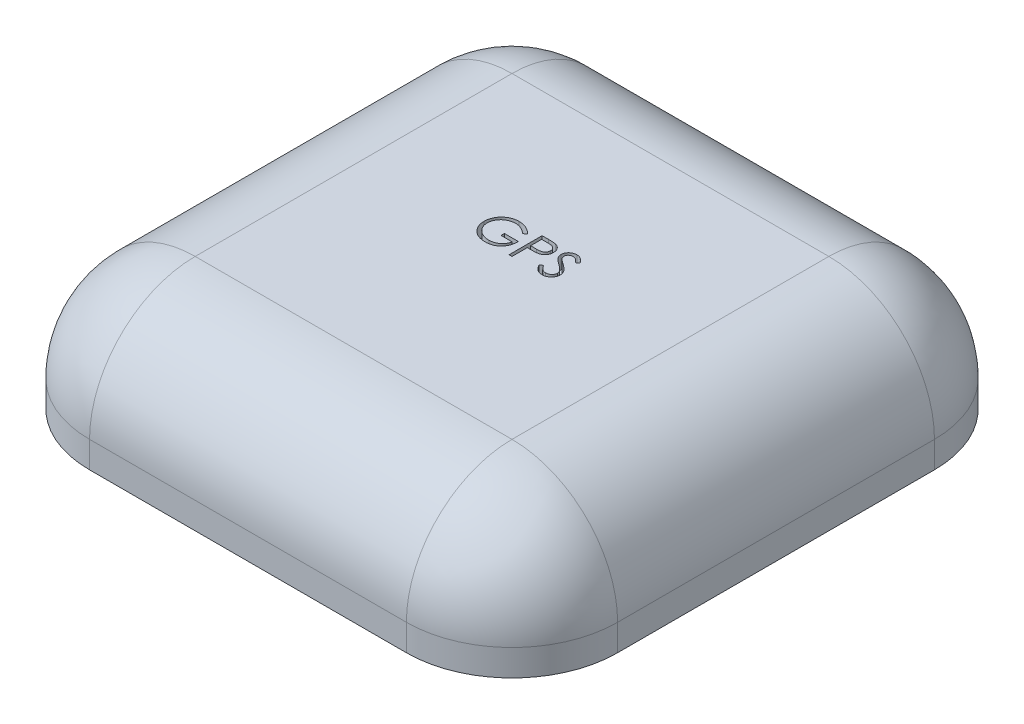
from build123d import *

# Parameters (mm, degrees)
SKETCH1_W           = 50.8
SKETCH1_H           = 50.8
BOSS_EXTRUDE1_DEPTH = 12.7
FILLET1_R           = 10.16
CUT_EXTRUDE1_DEPTH  = 1.27


with BuildPart() as part:
    # Sketch1 → Boss-Extrude1 (new body)
    with BuildSketch(Plane(origin=(0, 0, 0), x_dir=(1, 0, 0), z_dir=(0, 1, 0))):
        Rectangle(SKETCH1_W, SKETCH1_H)
    extrude(amount=BOSS_EXTRUDE1_DEPTH)

    # Fillet1
    fillet1_edges = [part.edges().sort_by_distance(p)[0] for p in [
        (-25.4, 6.35, -25.4),
        (25.4, 6.35, -25.4),
        (25.4, 6.35, 25.4),
        (-25.4, 6.35, 25.4),
        (-25.4, 12.7, 0),
        (0, 12.7, -25.4),
        (25.4, 12.7, 0),
        (0, 12.7, 25.4),
    ]]
    fillet(fillet1_edges, radius=FILLET1_R)

    # Sketch2 → Cut-Extrude1 (cut)
    # profile 1 of 3: a face of its own
    with BuildSketch(Plane(origin=(0, 12.7, 0), x_dir=(1, 0, 0), z_dir=(0, 1, 0))):
        with BuildLine():
            Line((-1.135791938, 2.633112981), (-1.380022707, 2.401602564))
            add(Edge.make_bspline(
                [(-1.380022707, 2.401602564), (-1.424217699, 2.443177704), (-1.511553827, 2.525336601), (-1.65393919, 2.631935861), (-1.802496201, 2.723254395), (-1.95644968, 2.797555052), (-2.111987082, 2.856839342), (-2.267043901, 2.899047012), (-2.420029644, 2.925964242), (-2.521781335, 2.92918312), (-2.571919743, 2.930769231)],
                knots=[0, 0, 0, 0, 1.08915593, 2.152340314, 3.188132944, 4.216796309, 5.218260357, 6.173443236, 7.099959455, 8, 8, 8, 8], degree=3))
            add(Edge.make_bspline(
                [(-2.571919743, 2.930769231), (-2.60268522, 2.930394031), (-2.664136384, 2.929644605), (-2.755414862, 2.920079495), (-2.845736026, 2.906322797), (-2.934929373, 2.88641838), (-3.023168326, 2.86119159), (-3.110145992, 2.829636205), (-3.196024621, 2.792846805), (-3.27999528, 2.750335847), (-3.361402737, 2.703636272), (-3.438289295, 2.651885096), (-3.511145021, 2.596740979), (-3.57860055, 2.536823305), (-3.641043898, 2.47267482), (-3.69996135, 2.405488821), (-3.753280754, 2.33342973), (-3.801442025, 2.257823341), (-3.844405779, 2.179997569), (-3.8823322, 2.1007015), (-3.914170273, 2.020198146), (-3.939361136, 1.93838649), (-3.960144372, 1.855899455), (-3.974765344, 1.772165887), (-3.983008299, 1.687096129), (-3.984434128, 1.630130045), (-3.985150913, 1.601492388)],
                knots=[0, 0, 0, 0, 1.02818874, 2.053710826, 3.065248034, 4.081641283, 5.106893873, 6.131558223, 7.173050175, 8.228653731, 9.27666206, 10.308777013, 11.325269123, 12.329503258, 13.32196095, 14.316845687, 15.314881793, 16.315733098, 17.311955233, 18.285320748, 19.252783886, 20.203351036, 21.145449891, 22.095197417, 23.042428769, 24, 24, 24, 24], degree=3))
            add(Edge.make_bspline(
                [(-3.985150913, 1.601492388), (-3.984465368, 1.572218146), (-3.983096151, 1.513749602), (-3.974332861, 1.426487836), (-3.958069386, 1.340522078), (-3.93632725, 1.255569843), (-3.909130367, 1.17148564), (-3.87522802, 1.088634006), (-3.835072797, 1.007018008), (-3.788593925, 0.927373027), (-3.737625012, 0.849791427), (-3.680526645, 0.776712433), (-3.619874545, 0.707162899), (-3.553459078, 0.642687027), (-3.483409922, 0.581560207), (-3.407634215, 0.525466555), (-3.327621983, 0.473325596), (-3.243251155, 0.425794467), (-3.155437202, 0.383332438), (-3.065397148, 0.345573618), (-2.972843343, 0.314477362), (-2.878262189, 0.289133511), (-2.781766436, 0.26835967), (-2.682866272, 0.254995206), (-2.582288886, 0.245297095), (-2.51449027, 0.244588008), (-2.480333204, 0.244230769)],
                knots=[0, 0, 0, 0, 0.93586088, 1.869166235, 2.799637598, 3.729985548, 4.670839027, 5.622275134, 6.589130586, 7.576015415, 8.568469353, 9.55398029, 10.53834874, 11.515998671, 12.510579167, 13.508179873, 14.527009472, 15.561807829, 16.601455013, 17.643573243, 18.680854198, 19.719860599, 20.772568776, 21.833555941, 22.908541556, 24, 24, 24, 24], degree=3))
            add(Edge.make_bspline(
                [(-2.480333204, 0.244230769), (-2.439168561, 0.245091263), (-2.358335095, 0.246780984), (-2.239511679, 0.259934818), (-2.125390322, 0.280478695), (-2.016291695, 0.310564901), (-1.912089083, 0.348940378), (-1.812400487, 0.395200478), (-1.718010768, 0.451119539), (-1.628636175, 0.514232975), (-1.546306442, 0.584550002), (-1.472053058, 0.660427472), (-1.407060364, 0.741497075), (-1.350359673, 0.827281326), (-1.303452536, 0.918490281), (-1.264950858, 1.014676963), (-1.235438515, 1.115884634), (-1.223323645, 1.185817757), (-1.217202195, 1.221153846)],
                knots=[0, 0, 0, 0, 1.13008108, 2.219097802, 3.278683437, 4.311054135, 5.322181354, 6.324827112, 7.324222904, 8.330512327, 9.32562643, 10.293043162, 11.24128371, 12.174520618, 13.111833804, 14.052305215, 15.015860969, 16, 16, 16, 16], degree=3))
            Line((-1.217202195, 1.221153846), (-2.275535528, 1.221153846))
            Line((-2.275535528, 1.221153846), (-2.275535528, 1.546794872))
            Line((-2.275535528, 1.546794872), (-0.932266297, 1.546794872))
            add(Edge.make_bspline(
                [(-0.932266297, 1.546794872), (-0.933813745, 1.486100221), (-0.936842381, 1.367309826), (-0.958086683, 1.194072509), (-0.992391662, 1.030449616), (-1.039254945, 0.876268829), (-1.099920378, 0.731748642), (-1.173736886, 0.59674232), (-1.261885881, 0.472122045), (-1.361227496, 0.356870449), (-1.472715315, 0.254064664), (-1.593336849, 0.163707849), (-1.723291384, 0.087596191), (-1.862455995, 0.025674018), (-2.010375103, -0.022653106), (-2.16739099, -0.056917322), (-2.333290728, -0.077445931), (-2.446988999, -0.080068825), (-2.505137892, -0.081410256)],
                knots=[0, 0, 0, 0, 1.140356446, 2.231883559, 3.274166699, 4.278491846, 5.25512956, 6.21435461, 7.1637429, 8.11826594, 9.068280886, 10.0076534, 10.945064095, 11.891975133, 12.864533718, 13.863980011, 14.907571808, 16, 16, 16, 16], degree=3))
            add(Edge.make_bspline(
                [(-2.505137892, -0.081410256), (-2.540979229, -0.080893982), (-2.611669897, -0.079875723), (-2.71607381, -0.072639129), (-2.81759908, -0.061498892), (-2.916230917, -0.044675816), (-3.012332127, -0.02407038), (-3.105422751, 0.00231543), (-3.195857403, 0.03285775), (-3.283775861, 0.067597396), (-3.368380128, 0.107848828), (-3.45004704, 0.152579715), (-3.529228026, 0.201559407), (-3.605383725, 0.25563496), (-3.678910939, 0.314401906), (-3.749335563, 0.377978032), (-3.817051852, 0.446168976), (-3.859470273, 0.494591364), (-3.880844022, 0.518990385)],
                knots=[0, 0, 0, 0, 1.107784379, 2.184907829, 3.233506516, 4.263428166, 5.276301166, 6.270063455, 7.25232949, 8.225834625, 9.190232166, 10.146266622, 11.1027726, 12.066435141, 13.031522626, 14.010570082, 14.99756817, 16, 16, 16, 16], degree=3))
            add(Edge.make_bspline(
                [(-3.880844022, 0.518990385), (-3.911855546, 0.557698763), (-3.973363834, 0.634473), (-4.05253759, 0.757481521), (-4.120030292, 0.884846065), (-4.17479253, 1.016921192), (-4.217553509, 1.153583364), (-4.248220609, 1.29465795), (-4.26618865, 1.440326615), (-4.268777216, 1.538901533), (-4.27008681, 1.588772035)],
                knots=[0, 0, 0, 0, 1.023165419, 2.029347347, 3.013907458, 3.994755782, 4.975994455, 5.96558838, 6.970761222, 8, 8, 8, 8], degree=3))
            add(Edge.make_bspline(
                [(-4.27008681, 1.588772035), (-4.269603994, 1.626115707), (-4.268644498, 1.700328436), (-4.257009923, 1.810507565), (-4.240317208, 1.918730336), (-4.215781666, 2.024908283), (-4.184851483, 2.12911232), (-4.146249392, 2.23139083), (-4.101305093, 2.331804171), (-4.049066822, 2.42966118), (-3.990933062, 2.523663326), (-3.927841076, 2.61343219), (-3.858894953, 2.697332985), (-3.785220621, 2.776428266), (-3.705939066, 2.849724363), (-3.621793017, 2.917899877), (-3.532717627, 2.98104626), (-3.438432664, 3.038168896), (-3.340345407, 3.08948018), (-3.238690978, 3.134464679), (-3.133500406, 3.171642401), (-3.025561765, 3.203187187), (-2.914058032, 3.226514493), (-2.799798367, 3.243431569), (-2.682187194, 3.255007256), (-2.602688796, 3.255938217), (-2.562379478, 3.256410256)],
                knots=[0, 0, 0, 0, 1.008945113, 2.00506715, 2.99143336, 3.967273523, 4.948097931, 5.927297278, 6.919902385, 7.919676788, 8.923139349, 9.905703106, 10.883022732, 11.856032218, 12.825136022, 13.798837087, 14.781400844, 15.773989409, 16.776158564, 17.77167057, 18.775803737, 19.789618931, 20.80898985, 21.851988756, 22.910860228, 24, 24, 24, 24], degree=3))
            add(Edge.make_bspline(
                [(-2.562379478, 3.256410256), (-2.529506214, 3.255884575), (-2.464322395, 3.254842209), (-2.367325481, 3.247617136), (-2.271827817, 3.236165472), (-2.177687807, 3.220538316), (-2.085226032, 3.199253397), (-1.994179092, 3.173782381), (-1.904415005, 3.144126228), (-1.816215093, 3.108757774), (-1.728986308, 3.068613415), (-1.642243639, 3.023425524), (-1.556283466, 2.972421413), (-1.470956718, 2.915449634), (-1.385725333, 2.853488677), (-1.301937407, 2.784766415), (-1.217570451, 2.711992915), (-1.163321662, 2.659666934), (-1.135791938, 2.633112981)],
                knots=[0, 0, 0, 0, 0.985871117, 1.954866573, 2.915460327, 3.869826059, 4.81536089, 5.759505086, 6.70452669, 7.649098992, 8.607881297, 9.583363685, 10.581137262, 11.603961102, 12.659522466, 13.73993555, 14.853081303, 16, 16, 16, 16], degree=3))
        make_face()
    # profile 2 of 3: a face of its own
    with BuildSketch(Plane(origin=(0, 12.7, 0), x_dir=(1, 0, 0), z_dir=(0, 1, 0))):
        with BuildLine():
            Line((-0.280984246, 3.175), (0.341677012, 3.175))
            add(Edge.make_bspline(
                [(0.341677012, 3.175), (0.384504048, 3.174952923), (0.466562552, 3.17486272), (0.584232638, 3.172127915), (0.691102895, 3.16847513), (0.786942883, 3.163411556), (0.872047486, 3.157427506), (0.946031608, 3.149034585), (1.009476777, 3.140271317), (1.047491913, 3.131361898), (1.064829055, 3.127298678)],
                knots=[0, 0, 0, 0, 1.415646017, 2.712440637, 3.8905458, 4.950247383, 5.884950622, 6.709939814, 7.411656543, 8, 8, 8, 8], degree=3))
            add(Edge.make_bspline(
                [(1.064829055, 3.127298678), (1.086776047, 3.121291623), (1.130152876, 3.109419063), (1.192655965, 3.085639471), (1.252122668, 3.057443507), (1.30875701, 3.025308933), (1.361863043, 2.987857028), (1.412233094, 2.946605961), (1.459422648, 2.900603324), (1.503166339, 2.850365081), (1.543338977, 2.796734605), (1.577928046, 2.738911296), (1.606890602, 2.677868471), (1.631731141, 2.613648589), (1.649609525, 2.545712367), (1.663077784, 2.474531849), (1.67162636, 2.400114666), (1.672445113, 2.349260357), (1.672861908, 2.323372396)],
                knots=[0, 0, 0, 0, 0.999701418, 1.975846123, 2.934577507, 3.890451536, 4.834027766, 5.787354733, 6.749476667, 7.726910423, 8.712836071, 9.690891519, 10.682875813, 11.679750201, 12.712814741, 13.765529915, 14.8625177, 16, 16, 16, 16], degree=3))
            add(Edge.make_bspline(
                [(1.672861908, 2.323372396), (1.672479616, 2.297266841), (1.671731635, 2.24618956), (1.66275429, 2.171465674), (1.650661902, 2.100056849), (1.632068147, 2.032121418), (1.607715287, 1.968062827), (1.579147496, 1.906902138), (1.544691008, 1.849679864), (1.505098912, 1.796188264), (1.46105568, 1.74637713), (1.412747658, 1.700607423), (1.360369871, 1.659147059), (1.304088779, 1.62190309), (1.243355702, 1.589739179), (1.179091749, 1.560930767), (1.110738338, 1.536736305), (1.063437629, 1.524009035), (1.03938835, 1.517538061)],
                knots=[0, 0, 0, 0, 1.121902311, 2.195077645, 3.232258892, 4.234102512, 5.217864754, 6.176164875, 7.132989551, 8.084763148, 9.034132444, 9.988522005, 10.94243251, 11.903244335, 12.886203696, 13.894208494, 14.929344452, 16, 16, 16, 16], degree=3))
            add(Edge.make_bspline(
                [(1.03938835, 1.517538061), (1.019497126, 1.513308071), (0.975904351, 1.504037802), (0.904110596, 1.493688702), (0.820521567, 1.484855307), (0.725251356, 1.478232132), (0.618385478, 1.472562155), (0.499866123, 1.468055384), (0.369460639, 1.465579017), (0.278500296, 1.465451298), (0.231009945, 1.465384615)],
                knots=[0, 0, 0, 0, 0.601384939, 1.31797006, 2.144135048, 3.087295005, 4.142315834, 5.309527816, 6.595305764, 8, 8, 8, 8], degree=3))
            Line((0.231009945, 1.465384615), (0.003951652, 1.465384615))
            Line((0.003951652, 1.465384615), (0.003951652, 0))
            Line((0.003951652, 0), (-0.280984246, 0))
            Line((-0.280984246, 0), (-0.280984246, 3.175))
        make_face()
        with BuildLine():
            Line((0.003951652, 2.849358974), (0.003951652, 1.791025641))
            Line((0.003951652, 1.791025641), (0.559831059, 1.784029447))
            add(Edge.make_bspline(
                [(0.559831059, 1.784029447), (0.586972706, 1.784015419), (0.639369096, 1.783988339), (0.715057669, 1.787603506), (0.785278952, 1.791776847), (0.849817245, 1.797887291), (0.908701643, 1.806524432), (0.962030329, 1.815243652), (1.009389793, 1.827857802), (1.064815498, 1.8448423), (1.12657682, 1.873809745), (1.193766668, 1.915855716), (1.250708557, 1.969450359), (1.299983012, 2.029709891), (1.339086201, 2.096746959), (1.367711994, 2.16847378), (1.384531472, 2.244154758), (1.386786805, 2.295941855), (1.387926011, 2.322100361)],
                knots=[0, 0, 0, 0, 1.160613943, 2.240541288, 3.23993089, 4.169200891, 5.011653406, 5.7853311, 6.478053781, 7.106038997, 8.262395093, 9.384106736, 10.481365981, 11.59014053, 12.70357646, 13.786202915, 14.881775077, 16, 16, 16, 16], degree=3))
            add(Edge.make_bspline(
                [(1.387926011, 2.322100361), (1.38678061, 2.347626012), (1.384503695, 2.398367848), (1.367580162, 2.472734295), (1.339141856, 2.543705256), (1.299720516, 2.609902269), (1.251876777, 2.669944969), (1.196269516, 2.722103078), (1.133029629, 2.764032765), (1.074203019, 2.791095813), (1.021950515, 2.80761967), (0.97656438, 2.819181061), (0.925319268, 2.82841179), (0.868198496, 2.835886196), (0.805644797, 2.842284693), (0.737120754, 2.846626258), (0.662885949, 2.849167579), (0.611350646, 2.849293631), (0.584635746, 2.849358974)],
                knots=[0, 0, 0, 0, 1.120700087, 2.227813068, 3.331159281, 4.466773991, 5.599788987, 6.693661531, 7.80175334, 8.91857717, 9.525282508, 10.207424825, 10.974604443, 11.810962634, 12.737642355, 13.736264703, 14.826523623, 16, 16, 16, 16], degree=3))
            Line((0.584635746, 2.849358974), (0.003951652, 2.849358974))
        make_face(mode=Mode.SUBTRACT)
    # profile 3 of 3: a face of its own
    with BuildSketch(Plane(origin=(0, 12.7, 0), x_dir=(1, 0, 0), z_dir=(0, 1, 0))):
        with BuildLine():
            Line((1.998502934, 0.612484976), (2.266902373, 0.773397436))
            add(Edge.make_bspline(
                [(2.266902373, 0.773397436), (2.291865345, 0.731610458), (2.339693437, 0.651548221), (2.419477884, 0.543364142), (2.502148453, 0.451414185), (2.588317349, 0.376233263), (2.677458602, 0.317043201), (2.770154136, 0.275131177), (2.866091579, 0.24899097), (2.931382117, 0.245815892), (2.963977693, 0.244230769)],
                knots=[0, 0, 0, 0, 1.272034388, 2.437168799, 3.508375237, 4.49857839, 5.41946034, 6.295179144, 7.148887113, 8, 8, 8, 8], degree=3))
            add(Edge.make_bspline(
                [(2.963977693, 0.244230769), (2.99181506, 0.245006079), (3.047002704, 0.246543133), (3.128248453, 0.261312147), (3.207153373, 0.284001721), (3.282091209, 0.316496423), (3.352027945, 0.355810621), (3.413356876, 0.403296082), (3.46637585, 0.456460283), (3.509745547, 0.515771691), (3.543019579, 0.57955939), (3.568593812, 0.645033288), (3.582786129, 0.713221918), (3.584924041, 0.759132838), (3.586002934, 0.782301683)],
                knots=[0, 0, 0, 0, 1.095163259, 2.171163733, 3.241058638, 4.321873601, 5.38011039, 6.391990106, 7.366004449, 8.327778327, 9.272591725, 10.192022065, 11.087607919, 12, 12, 12, 12], degree=3))
            add(Edge.make_bspline(
                [(3.586002934, 0.782301683), (3.584665523, 0.808736596), (3.581946763, 0.862474913), (3.558967492, 0.941758884), (3.522818532, 1.020220001), (3.489469563, 1.068753292), (3.472155778, 1.093950321)],
                knots=[0, 0, 0, 0, 0.938893495, 1.908633276, 2.914225137, 4, 4, 4, 4], degree=3))
            add(Edge.make_bspline(
                [(3.472155778, 1.093950321), (3.457940292, 1.112135653), (3.428096658, 1.150313485), (3.376790915, 1.207141663), (3.316587368, 1.2657598), (3.249546286, 1.32840623), (3.173225556, 1.392167303), (3.090015596, 1.460083527), (2.997791953, 1.5295721), (2.933113124, 1.576174356), (2.899739913, 1.600220353)],
                knots=[0, 0, 0, 0, 0.722233717, 1.516239348, 2.393582979, 3.351407094, 4.387010283, 5.505090956, 6.712668013, 8, 8, 8, 8], degree=3))
            add(Edge.make_bspline(
                [(2.899739913, 1.600220353), (2.866335288, 1.624013428), (2.802468188, 1.669503978), (2.713152188, 1.737017435), (2.633283283, 1.798742946), (2.563216461, 1.855261585), (2.502982541, 1.90658102), (2.452106875, 1.952208436), (2.41188547, 1.993377809), (2.389519336, 2.020085312), (2.379477493, 2.032076322)],
                knots=[0, 0, 0, 0, 1.452282411, 2.77665338, 3.964542531, 5.026858415, 5.96415736, 6.766646006, 7.446254459, 8, 8, 8, 8], degree=3))
            add(Edge.make_bspline(
                [(2.379477493, 2.032076322), (2.365441684, 2.050764406), (2.337838382, 2.08751703), (2.301402077, 2.144961722), (2.270432979, 2.203765684), (2.246155721, 2.264086933), (2.225712151, 2.325078618), (2.211961743, 2.387536534), (2.20335169, 2.451180424), (2.202469959, 2.494009814), (2.202028575, 2.51544972)],
                knots=[0, 0, 0, 0, 1.068054152, 2.10047183, 3.106115577, 4.101338837, 5.06977816, 6.043150881, 7.020423561, 8, 8, 8, 8], degree=3))
            add(Edge.make_bspline(
                [(2.202028575, 2.51544972), (2.203212586, 2.549041015), (2.2055553, 2.615505616), (2.225367769, 2.712597869), (2.256639609, 2.805295548), (2.300449971, 2.892680922), (2.356926284, 2.972478633), (2.422282275, 3.045606582), (2.500125552, 3.107082367), (2.585535432, 3.160796163), (2.679022284, 3.202838538), (2.77698546, 3.234553141), (2.879580661, 3.252522968), (2.949070648, 3.255101762), (2.984330257, 3.256410256)],
                knots=[0, 0, 0, 0, 1.005424448, 1.989358655, 2.955360095, 3.929531133, 4.905563448, 5.876582895, 6.856512386, 7.866279853, 8.892233794, 9.918561126, 10.94386622, 12, 12, 12, 12], degree=3))
            add(Edge.make_bspline(
                [(2.984330257, 3.256410256), (3.021744548, 3.255119799), (3.096149632, 3.252553491), (3.205595706, 3.230240016), (3.31097007, 3.193318692), (3.39573646, 3.151418981), (3.462078322, 3.109571197), (3.512672158, 3.071453213), (3.56394156, 3.027570079), (3.616300081, 2.977804906), (3.668860537, 2.921701067), (3.72240324, 2.8596428), (3.777053398, 2.792009352), (3.8122105, 2.743727127), (3.830233703, 2.718975361)],
                knots=[0, 0, 0, 0, 1.286793592, 2.559021753, 3.825965368, 5.121522368, 5.803751409, 6.523245864, 7.299691795, 8.125521123, 9.008227632, 9.944561021, 10.946284179, 12, 12, 12, 12], degree=3))
            Line((3.830233703, 2.718975361), (3.572646563, 2.523717949))
            add(Edge.make_bspline(
                [(3.572646563, 2.523717949), (3.557092753, 2.543755546), (3.527139751, 2.582343275), (3.481665146, 2.636382968), (3.438803872, 2.685746489), (3.396576009, 2.728622712), (3.357211787, 2.767359647), (3.319005613, 2.80052457), (3.282507308, 2.828442431), (3.236499825, 2.858236232), (3.178698752, 2.887769632), (3.106141351, 2.912760581), (3.030316659, 2.927778387), (2.97867335, 2.929764021), (2.952529376, 2.930769231)],
                knots=[0, 0, 0, 0, 1.181633172, 2.275549214, 3.290209073, 4.226197932, 5.078386478, 5.862611352, 6.581680152, 7.217281963, 8.414376989, 9.595101626, 10.782541182, 12, 12, 12, 12], degree=3))
            add(Edge.make_bspline(
                [(2.952529376, 2.930769231), (2.919730245, 2.929670046), (2.85648021, 2.927550371), (2.766681925, 2.904400099), (2.685861007, 2.867949411), (2.616416894, 2.816863681), (2.558598351, 2.756338209), (2.516774113, 2.686688819), (2.49160075, 2.609779068), (2.48852891, 2.556129137), (2.486964472, 2.52880609)],
                knots=[0, 0, 0, 0, 1.14458467, 2.207223713, 3.21896685, 4.227309161, 5.202851033, 6.127160689, 7.046193047, 8, 8, 8, 8], degree=3))
            add(Edge.make_bspline(
                [(2.486964472, 2.52880609), (2.487321094, 2.51179582), (2.488034921, 2.477747465), (2.497990631, 2.427445104), (2.510780736, 2.377269817), (2.531048695, 2.327447189), (2.559029792, 2.277105877), (2.595773773, 2.225379015), (2.642050134, 2.17181068), (2.677498567, 2.136969705), (2.696214272, 2.11857472)],
                knots=[0, 0, 0, 0, 0.858281714, 1.717966888, 2.583508476, 3.4729293, 4.427298488, 5.488583878, 6.674047936, 8, 8, 8, 8], degree=3))
            add(Edge.make_bspline(
                [(2.696214272, 2.11857472), (2.703164231, 2.11237256), (2.719675743, 2.09763765), (2.749861762, 2.073514653), (2.789724157, 2.043757852), (2.838222011, 2.006939358), (2.896249546, 1.964229746), (2.963813144, 1.916175112), (3.040159677, 1.861215445), (3.094335987, 1.822791105), (3.1229821, 1.802473958)],
                knots=[0, 0, 0, 0, 0.420754252, 0.999615792, 1.744751191, 2.668019286, 3.750313428, 4.999500688, 6.413464383, 8, 8, 8, 8], degree=3))
            add(Edge.make_bspline(
                [(3.1229821, 1.802473958), (3.15744075, 1.777399296), (3.22416515, 1.728845689), (3.319104526, 1.655897179), (3.405186766, 1.584552418), (3.482714101, 1.515267017), (3.552452439, 1.448566533), (3.613628086, 1.383648505), (3.666864382, 1.320978021), (3.724176958, 1.240630042), (3.782740123, 1.141950058), (3.833033491, 1.021047656), (3.864745706, 0.899675279), (3.868892723, 0.818098792), (3.870938831, 0.777849559)],
                knots=[0, 0, 0, 0, 1.163667725, 2.253281268, 3.268753668, 4.215851969, 5.092017293, 5.902905408, 6.650798638, 7.335211899, 8.59617414, 9.77448103, 10.901945474, 12, 12, 12, 12], degree=3))
            add(Edge.make_bspline(
                [(3.870938831, 0.777849559), (3.870342713, 0.7493849), (3.869162053, 0.693008344), (3.855590367, 0.610226953), (3.835706099, 0.529826093), (3.805736608, 0.452799584), (3.769157743, 0.377738263), (3.722742647, 0.306611097), (3.668942104, 0.237843864), (3.60722576, 0.173270268), (3.539692692, 0.113991933), (3.46831534, 0.06126057), (3.392976878, 0.017292877), (3.314086006, -0.018585387), (3.2316246, -0.046646507), (3.145620396, -0.066978181), (3.055931625, -0.079456576), (2.994971188, -0.080751759), (2.963977693, -0.081410256)],
                knots=[0, 0, 0, 0, 0.983748083, 1.948392443, 2.894712957, 3.844097841, 4.80183111, 5.778335162, 6.776009319, 7.81870978, 8.863265674, 9.881300176, 10.883814829, 11.87499822, 12.874611388, 13.892143829, 14.928324115, 16, 16, 16, 16], degree=3))
            add(Edge.make_bspline(
                [(2.963977693, -0.081410256), (2.939997061, -0.080946542), (2.892337807, -0.080024952), (2.821844205, -0.071877648), (2.752774721, -0.06035049), (2.685996051, -0.042049726), (2.620647827, -0.019845611), (2.557014265, 0.007494162), (2.495064523, 0.040257623), (2.43445143, 0.07771811), (2.375329143, 0.12131335), (2.318252197, 0.172089307), (2.261347865, 0.228645587), (2.206295726, 0.292518026), (2.151982231, 0.362674716), (2.099478245, 0.439772046), (2.047696973, 0.523390074), (2.015207227, 0.582231974), (1.998502934, 0.612484976)],
                knots=[0, 0, 0, 0, 0.915332311, 1.819136955, 2.706846663, 3.586547465, 4.459518054, 5.340707479, 6.227863349, 7.133153174, 8.059268498, 9.028702269, 10.047606654, 11.120612155, 12.245963614, 13.433783089, 14.680604001, 16, 16, 16, 16], degree=3))
        make_face()
    extrude(amount=-CUT_EXTRUDE1_DEPTH, mode=Mode.SUBTRACT)


solid = part.part
